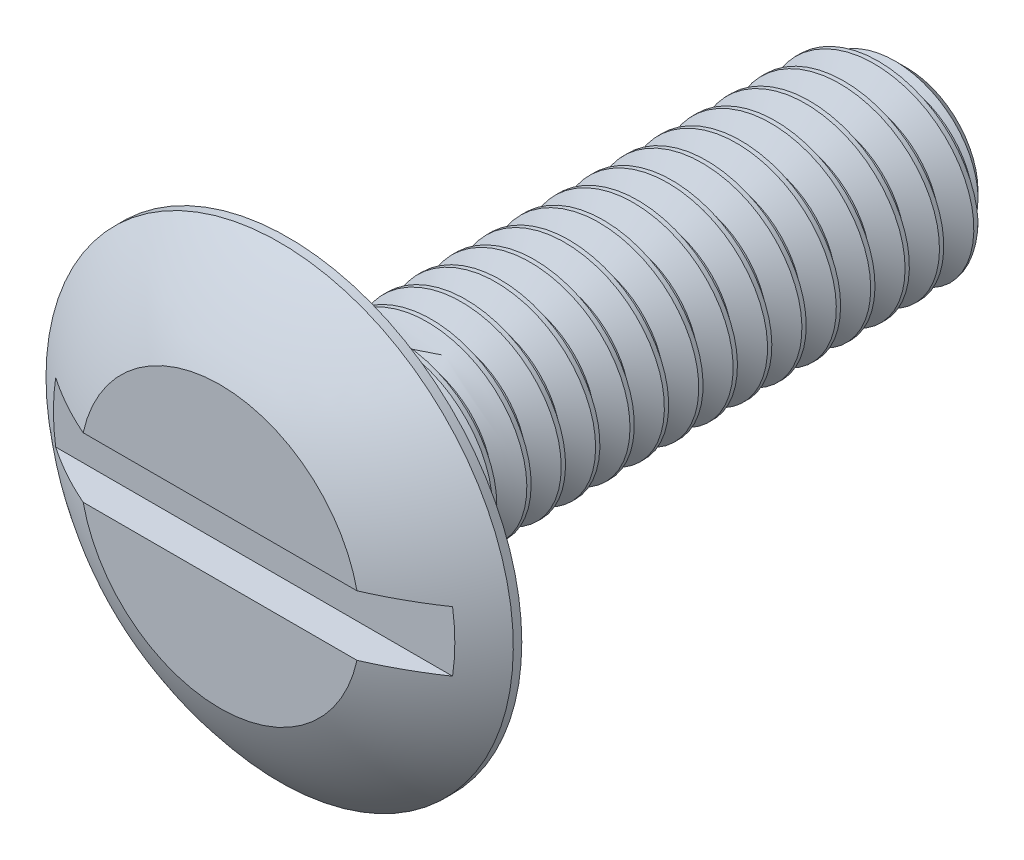
from build123d import *

# Parameters (mm, degrees)
CHAMFER1_SIZE                 = 1.058333333
SKETCH3_W                     = 19.177
SKETCH3_H                     = 2.469444444
CUT_EXTRUDE1_DEPTH            = 1.397
CUT_SWEEP1_PITCH              = 1.411111111
CUT_SWEEP1_TO                 = 25.4
SKETCH6_R                     = 3.96875
BOSS_EXTRUDE1_DEPTH           = 0.1397
BOSS_EXTRUDE1_OTHER_WAY_DEPTH = 2.54
BOSS_EXTRUDE1_OTHER_WAY_TAPER = 45


with BuildPart() as part:
    # Sketch2 → Revolve1 (revolve)
    with BuildSketch(Plane(origin=(0, 0, 0), x_dir=(0, 0, -1), z_dir=(1, 0, 0)), mode=Mode.PRIVATE) as revolve1_sk:
        with BuildLine():
            Line((25.4, 0), (25.4, 3.96875))
            Line((25.4, 3.96875), (0, 3.96875))
            Line((0, 3.96875), (0, 9.5885))
            Line((0, 9.5885), (-0.34925, 9.5885))
            ThreePointArc((-0.34925, 9.5885), (-1.712988912, 7.760907791), (-2.794, 5.7531))
            Line((-2.794, 5.7531), (-2.794, 0))
            Line((-2.794, 0), (25.4, 0))
        make_face()
    revolve(revolve1_sk.sketch.rotate(Axis((0, 0, -25.4), (0, 0, 1)), 90), axis=Axis((0, 0, -25.4), (0, 0, 1)))

    # Chamfer1
    chamfer1_edges = [part.edges().sort_by_distance(p)[0] for p in [
        (3.96875, 0, -25.4),
    ]]
    chamfer(chamfer1_edges, length=CHAMFER1_SIZE)

    # Sketch3 → Cut-Extrude1 (cut)
    with BuildSketch(Plane.XY.offset(2.794)):
        Rectangle(SKETCH3_W, SKETCH3_H)
    extrude(amount=-CUT_EXTRUDE1_DEPTH, mode=Mode.SUBTRACT)


with BuildPart() as body_2:
    # Split1: read off the stored shape, not the designer's step
    # Split1: the piece on the far side of the plane
    add(part.part)
    split(bisect_by=Plane.XY, keep=Keep.BOTTOM)

    # Cut-Sweep1: arcs per turn and ends read off the stored shape
    # Cut-Sweep1: the profile of Sketch4 screwed along a right-hand helix through 19 turns, 8 arcs to a turn; built about Z, then put on its axis
    cut_sweep1_z = Axis((0, 0, 0), (0, 0, 1))
    cut_sweep1_corners = [(4.045128629, 0, 0.044097222), (4.045128629, 0, -1.278819444), (3.052206448, 0, -0.705555556), (3.052206448, 0, -0.529166667)]
    with BuildLine(mode=Mode.PRIVATE) as cut_sweep1_profile:
        Line(cut_sweep1_corners[0], cut_sweep1_corners[1])
        Line(cut_sweep1_corners[1], cut_sweep1_corners[2])
        Line(cut_sweep1_corners[2], cut_sweep1_corners[3])
        Line(cut_sweep1_corners[3], cut_sweep1_corners[0])
    cut_sweep1_cap = Face(cut_sweep1_profile.wire())
    cut_sweep1_turn_angles = [0, 22.5, 45, 67.5, 90, 112.5, 135, 157.5, 180, 202.5, 225, 247.5, 270, 292.5, 315, 337.5, 360]
    cut_sweep1_turn_weights = [1, 0.9238795325112867, 1, 0.9238795325112867, 1, 0.9238795325112867, 1, 0.9238795325112867, 1, 0.9238795325112867, 1, 0.9238795325112867, 1, 0.9238795325112867, 1, 0.9238795325112867, 1]
    cut_sweep1_turn_rails = [Edge.make_bspline([Vector(p[0], p[1], 0).rotate(cut_sweep1_z, cut_sweep1_turn_angles[k]) / cut_sweep1_turn_weights[k] + Vector(0, 0, p[2] + CUT_SWEEP1_PITCH * cut_sweep1_turn_angles[k] / 360) for k in range(17)], [0, 0, 0, 1, 1, 2, 2, 3, 3, 4, 4, 5, 5, 6, 6, 7, 7, 8, 8, 8], 2, cut_sweep1_turn_weights) for p in cut_sweep1_corners]
    cut_sweep1_turn_sides = [Face.make_surface_from_curves(cut_sweep1_turn_rails[p[0]], cut_sweep1_turn_rails[p[1]]) for p in [(0, 1), (1, 2), (2, 3), (3, 0)]]
    cut_sweep1 = Plane(origin=(0, 0, -25.4), x_dir=(0, 1, 0), z_dir=(0, 0, 1)) * split(Solid(Shell([*[p.moved(Location((0, 0, CUT_SWEEP1_PITCH * i))) for i in range(19) for p in cut_sweep1_turn_sides], cut_sweep1_cap, cut_sweep1_cap.rotate(cut_sweep1_z, 6840).moved(Location((0, 0, CUT_SWEEP1_PITCH * 6840 / 360)))])), bisect_by=Plane.XY.offset(CUT_SWEEP1_TO), keep=Keep.BOTTOM, mode=Mode.PRIVATE)
    add(cut_sweep1, mode=Mode.SUBTRACT)


with BuildPart() as part_1:
    add(part.part)

    # Split1
    split(bisect_by=Plane.XY, keep=Keep.TOP)

    add(body_2.part)  # Boss-Extrude1 merges body 2
    # Sketch6 → Boss-Extrude1 (add)
    with BuildSketch(Plane.XY):
        Circle(SKETCH6_R)
    extrude(amount=BOSS_EXTRUDE1_DEPTH)

    # Sketch6 → Boss-Extrude1 other way (add)
    with BuildSketch(Plane.XY):
        Circle(SKETCH6_R)
    extrude(amount=-BOSS_EXTRUDE1_OTHER_WAY_DEPTH, taper=BOSS_EXTRUDE1_OTHER_WAY_TAPER)


solid = part_1.part
